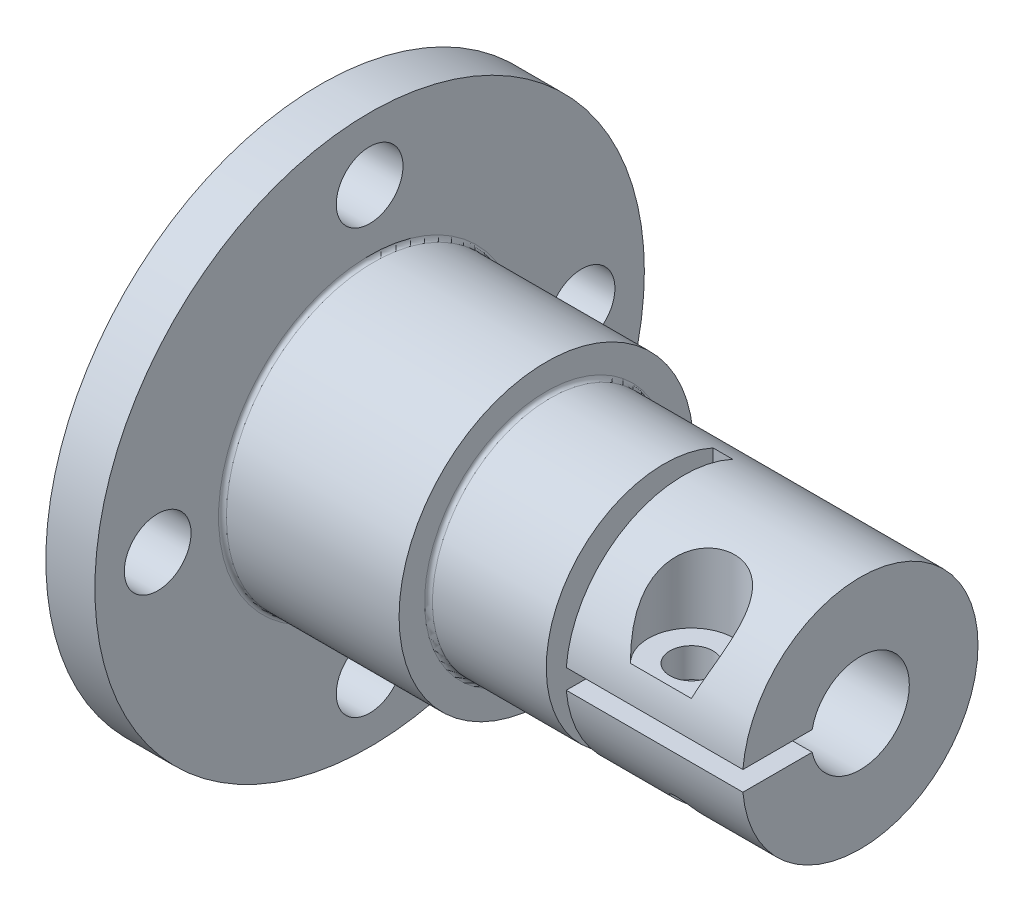
from build123d import *

# Parameters (mm, degrees)
SKETCH1_W                                     = 120
SKETCH1_H                                     = 34
BOSS_EXTRUDE1_DEPTH                           = 5
BOSS_EXTRUDE2_DEPTH                           = 9
SKETCH3_R                                     = 6
BOSS_EXTRUDE3_DEPTH                           = 16
CUT_EXTRUDE1_DEPTH                            = 9
SKETCH5_W                                     = 1
SKETCH5_H                                     = 12
CUT_EXTRUDE2_DEPTH                            = 8.5
CBORE_START                                   = 19
CBORE_FOR_M2_HEX_SOCKET_HEAD_CAP_SCREW1_DEPTH = 3.691221609
CBORE_START_2                                 = 17.5
CBORE_FOR_M2_HEX_SOCKET_HEAD_CAP_SCR_3_O_R    = 1.1
CBORE_FOR_M2_HEX_SOCKET_HEAD_CAP_SCR_3_DEPTH  = 1.5
M2_TAPPED_HOLE1_D                             = 1.6
FILLET1_R                                     = 0.2
SKETCH12_W                                    = 120
SKETCH12_H                                    = 34
SKETCH12_R                                    = 14
CUT_EXTRUDE3_DEPTH                            = 10
CUT_EXTRUDE4_DEPTH                            = 83.316462545
CUT_EXTRUDE4_DEPTH_BACK                       = 83.316462545
SKETCH13_W                                    = 2.5
SKETCH13_H                                    = 28
M3_CLEARANCE_HOLE1_D                          = 3.4
M3_CLEARANCE_HOLE1_DEPTH                      = 15
M3_CLEARANCE_HOLE1_TIP                        = 1.021463052


# Read off the part's stored shape, not the designer's step: CBORE for M2 Hex Socket Head Cap Screw1
with BuildPart() as part:
    # Sketch1 → Boss-Extrude1 (new body)
    with BuildSketch(Plane(origin=(0, 0, 0), x_dir=(0, 0, -1), z_dir=(1, 0, 0))):
        with Locations((-60, 17)):
            Rectangle(SKETCH1_W, SKETCH1_H)
    extrude(amount=BOSS_EXTRUDE1_DEPTH)

    # Sketch2 → Boss-Extrude2 (add)
    with BuildSketch(Plane(origin=(5, 0, 0), x_dir=(0, 0, -1), z_dir=(1, 0, 0))):
        with BuildLine():
            ThreePointArc((-52.5, 17), (-54.696699141, 22.303300859), (-60, 24.5))
            Line((-60, 24.5), (-60, 9.5))
            ThreePointArc((-60, 9.5), (-54.696699141, 11.696699141), (-52.5, 17))
        make_face()
        with BuildLine():
            Line((-60, 9.5), (-60, 24.5))
            ThreePointArc((-60, 24.5), (-67.5, 17), (-60, 9.5))
        make_face()
    extrude(amount=BOSS_EXTRUDE2_DEPTH)

    # Sketch3 → Boss-Extrude3 (add)
    with BuildSketch(Plane(origin=(14, 0, 0), x_dir=(0, 0, -1), z_dir=(1, 0, 0))):
        with Locations((-60, 17)):
            Circle(SKETCH3_R)
    extrude(amount=BOSS_EXTRUDE3_DEPTH)

    # Sketch4 → Cut-Extrude1 (cut)
    with BuildSketch(Plane(origin=(30, 0, 0), x_dir=(0, 0, -1), z_dir=(1, 0, 0))):
        with BuildLine():
            Line((-62.449489743, 17.5), (-67.449489743, 17.5))
            Line((-67.449489743, 17.5), (-67.449489743, 16.5))
            Line((-67.449489743, 16.5), (-62.449489743, 16.5))
            ThreePointArc((-62.449489743, 16.5), (-57.5, 17), (-62.449489743, 17.5))
        make_face()
    extrude(amount=-CUT_EXTRUDE1_DEPTH, mode=Mode.SUBTRACT)

    # Sketch5 → Cut-Extrude2 (cut)
    with BuildSketch(Plane.XY.offset(66)):
        with Locations((20.5, 17)):
            Rectangle(SKETCH5_W, SKETCH5_H)
    extrude(amount=-CUT_EXTRUDE2_DEPTH, mode=Mode.SUBTRACT)

    # CBORE for M2 Hex Socket Head Cap Scr 2 → CBORE for M2 Hex Socket Head Cap Screw1 (cut)
    with BuildSketch(Plane(origin=(0, 0, 0), x_dir=(1, 0, 0), z_dir=(0, 1, 0)).offset(CBORE_START)):
        with BuildLine():
            Line((25.709160843, -67), (27.054414631, -65.656854249))
            ThreePointArc((27.054414631, -65.656854249), (25.5, -61.9), (23.945585369, -65.656854249))
            Line((23.945585369, -65.656854249), (25.290839157, -67))
            Line((25.290839157, -67), (25.709160843, -67))
        make_face()
    extrude(amount=CBORE_FOR_M2_HEX_SOCKET_HEAD_CAP_SCREW1_DEPTH, mode=Mode.SUBTRACT)

    # CBORE for M2 Hex Socket Head Cap Scr 3 o → CBORE for M2 Hex Socket Head Cap Scr 3 (cut)
    with BuildSketch(Plane(origin=(0, 0, 0), x_dir=(1, 0, 0), z_dir=(0, 1, 0)).offset(CBORE_START_2)):
        with Locations((25.5, -64.1)):
            Circle(CBORE_FOR_M2_HEX_SOCKET_HEAD_CAP_SCR_3_O_R)
    extrude(amount=CBORE_FOR_M2_HEX_SOCKET_HEAD_CAP_SCR_3_DEPTH, mode=Mode.SUBTRACT)

    # M2 Tapped Hole1 (through all)
    with Locations(Plane(origin=(0, 16.5, 0), x_dir=(1, 0, 0), z_dir=(0, 1, 0))):
        with Locations((25.5, -64.1)):
            Hole(M2_TAPPED_HOLE1_D / 2)

    # Fillet1
    fillet1_edges = [part.edges().sort_by_distance(p)[0] for p in [
        (5, 24.5, 60),
        (14, 17, 66),
    ]]
    fillet(fillet1_edges, radius=FILLET1_R)

    # Sketch12 → Cut-Extrude3 (cut)
    with BuildSketch(Plane(origin=(5, 0, 0), x_dir=(0, 0, -1), z_dir=(1, 0, 0))):
        with Locations((-60, 17)):
            Rectangle(SKETCH12_W, SKETCH12_H)
        with Locations((-60, 17)):
            Circle(SKETCH12_R, mode=Mode.SUBTRACT)
    extrude(amount=-CUT_EXTRUDE3_DEPTH, mode=Mode.SUBTRACT)

    # Sketch13 → Cut-Extrude4 (cut, two sides: drawn at the far end of the back side and taken through both)
    with BuildSketch(Plane(origin=(0, 23, 0), x_dir=(1, 0, 0), z_dir=(0, 1, 0)).offset(-CUT_EXTRUDE4_DEPTH_BACK)):
        with Locations((1.25, -60)):
            Rectangle(SKETCH13_W, SKETCH13_H)
    extrude(amount=CUT_EXTRUDE4_DEPTH + CUT_EXTRUDE4_DEPTH_BACK, mode=Mode.SUBTRACT)

    # M3 Clearance Hole1
    with Locations(Plane(origin=(5, 0, 0), x_dir=(0, 0, -1), z_dir=(1, 0, 0))):
        with Locations((-60, 27.8), (-49.2, 17), (-60, 6.2), (-70.8, 17)):
            Hole(M3_CLEARANCE_HOLE1_D / 2, depth=M3_CLEARANCE_HOLE1_DEPTH)
            with Locations((0, 0, -(M3_CLEARANCE_HOLE1_DEPTH + M3_CLEARANCE_HOLE1_TIP / 2))):  # 118° drill point
                Cone(0, M3_CLEARANCE_HOLE1_D / 2, M3_CLEARANCE_HOLE1_TIP, mode=Mode.SUBTRACT)


solid = part.part
